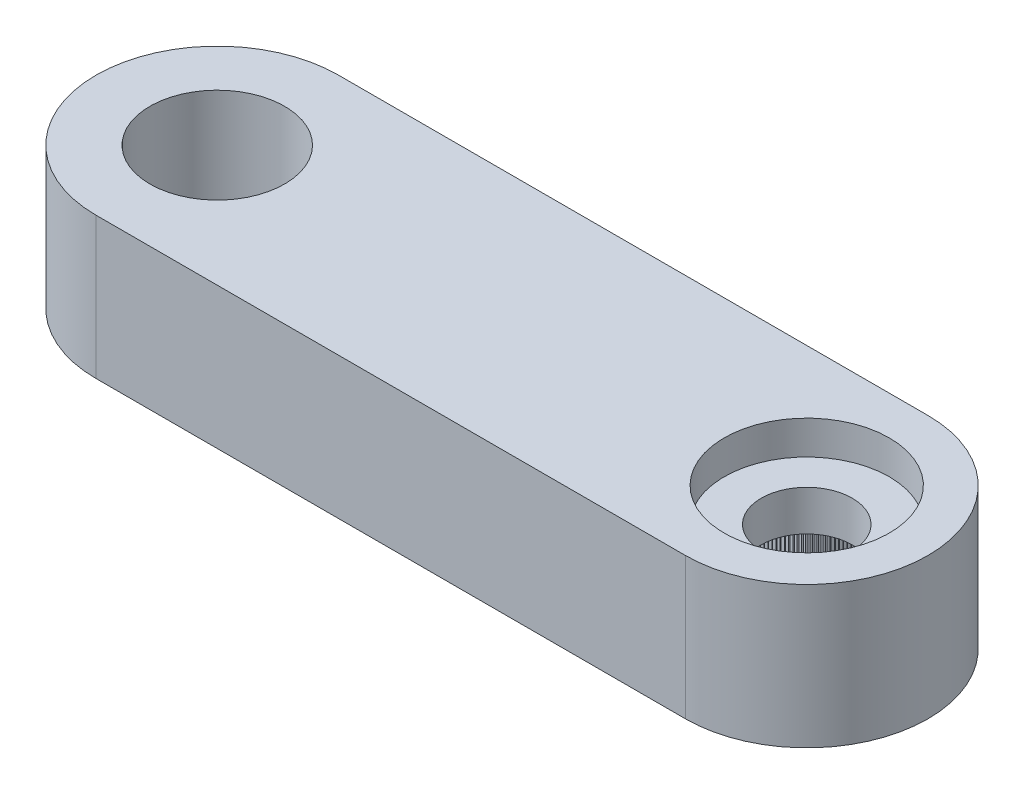
from build123d import *

# Parameters (mm, degrees)
BOSS_EXTRUDE1_DEPTH = 2
CIRPATTERN1_COUNT   = 150
BOSS_EXTRUDE2_START = -4.2
SKETCH4_R           = 2
BOSS_EXTRUDE2_DEPTH = 4.2


with BuildPart() as part:
    # Sketch2 → Revolve1 (revolve)
    with BuildSketch(Plane.XY, mode=Mode.PRIVATE) as revolve1_sk:
        Polygon((3.6, 4.2), (3.6, 0), (2.25, 0), (2.25, 2), (1.35, 2), (1.35, 3.2), (2.45, 3.2), (2.45, 4.2), align=None)
    revolve(revolve1_sk.sketch.rotate(Axis((0, 0, 0), (0, 1, 0)), 90), axis=Axis((0, 0, 0), (0, 1, 0)))

    # Sketch3 → Boss-Extrude1 (add)
    with BuildSketch(Plane.XZ.offset(-2)):
        with BuildLine():
            ThreePointArc((0.05, 2.249444376), (0, 2.25), (-0.05, 2.249444376))
            Line((-0.05, 2.249444376), (0, 2.149444376))
            Line((0, 2.149444376), (0.05, 2.249444376))
        make_face()
    boss_extrude1 = extrude(amount=BOSS_EXTRUDE1_DEPTH)

    # CirPattern1: Boss-Extrude1 ×150 about axis
    cirpattern1_axis = Axis((0, 0, 0), (0, 1, 0))
    for i in range(1, CIRPATTERN1_COUNT):
        add(boss_extrude1.rotate(cirpattern1_axis, i * 360 / CIRPATTERN1_COUNT))

    # Sketch4 → Boss-Extrude2 (add)
    with BuildSketch(Plane(origin=(0, 4.2, 0), x_dir=(1, 0, 0), z_dir=(0, 1, 0)).offset(BOSS_EXTRUDE2_START)):
        with BuildLine():
            Line((0, 3.6), (-17.5, 3.6))
            ThreePointArc((-17.5, 3.6), (-21.1, 0), (-17.5, -3.6))
            Line((-17.5, -3.6), (0, -3.6))
            ThreePointArc((0, -3.6), (-3.6, 0), (0, 3.6))
        make_face()
        with Locations(Location((-17.5, 0, 0), (0, 0, 270))):
            Circle(SKETCH4_R, mode=Mode.SUBTRACT)
    extrude(amount=BOSS_EXTRUDE2_DEPTH)


solid = part.part
